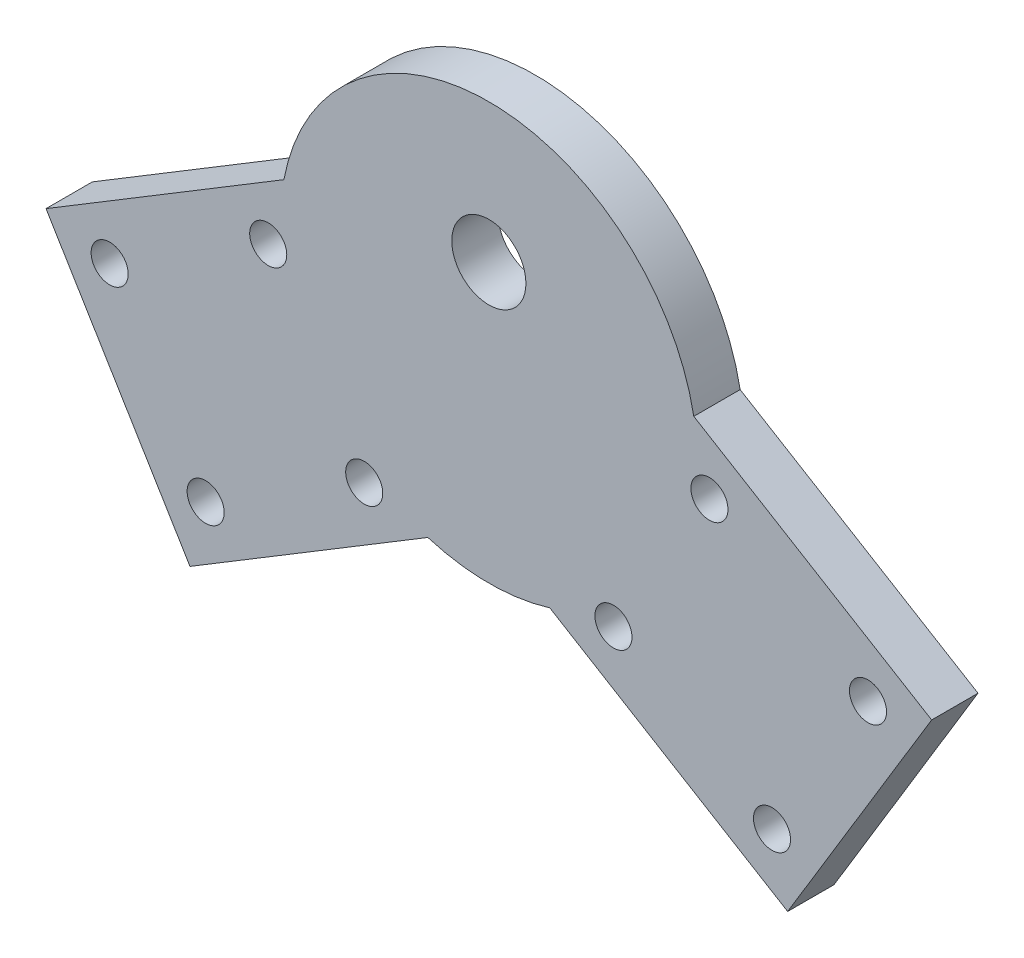
from build123d import *

# Parameters (mm, degrees)
SKETCH2_R           = 22.5
BOSS_EXTRUDE1_DEPTH = 5
SKETCH4_R           = 2
CUT_EXTRUDE1_DEPTH  = 10
SKETCH5_R           = 4
CUT_EXTRUDE2_DEPTH  = 10


with BuildPart() as part:
    # Sketch2 → Boss-Extrude1 (new body)
    with BuildSketch(Plane.XY):
        Circle(SKETCH2_R)
        Polygon((6.578363356, -21.516857009), (22.114553677, 4.146868175), (47.778278861, -11.389322146), (32.24208854, -37.05304733), align=None)
        Polygon((-6.578363356, -21.516857009), (-22.114553677, 4.146868175), (-47.778278861, -11.389322146), (-32.24208854, -37.05304733), align=None)
    extrude(amount=BOSS_EXTRUDE1_DEPTH)

    # Sketch4 → Cut-Extrude1 (cut)
    with BuildSketch(Plane.XY.offset(5)):
        with Locations((-40.911626277, -13.077244623)):
            Circle(SKETCH4_R)
        with Locations((-23.802476154, -2.719784409)):
            Circle(SKETCH4_R)
        with Locations((-13.44501594, -19.828934532)):
            Circle(SKETCH4_R)
        with Locations((-30.554166063, -30.186394746)):
            Circle(SKETCH4_R)
        with Locations((23.802476154, -2.719784409)):
            Circle(SKETCH4_R)
        with Locations((13.44501594, -19.828934532)):
            Circle(SKETCH4_R)
        with Locations((40.911626277, -13.077244623)):
            Circle(SKETCH4_R)
        with Locations((30.554166063, -30.186394746)):
            Circle(SKETCH4_R)
    extrude(amount=-CUT_EXTRUDE1_DEPTH, mode=Mode.SUBTRACT)

    # Sketch5 → Cut-Extrude2 (cut)
    with BuildSketch(Plane.XY.offset(5)):
        with Locations((0, 7.5)):
            Circle(SKETCH5_R)
    extrude(amount=-CUT_EXTRUDE2_DEPTH, mode=Mode.SUBTRACT)


solid = part.part
